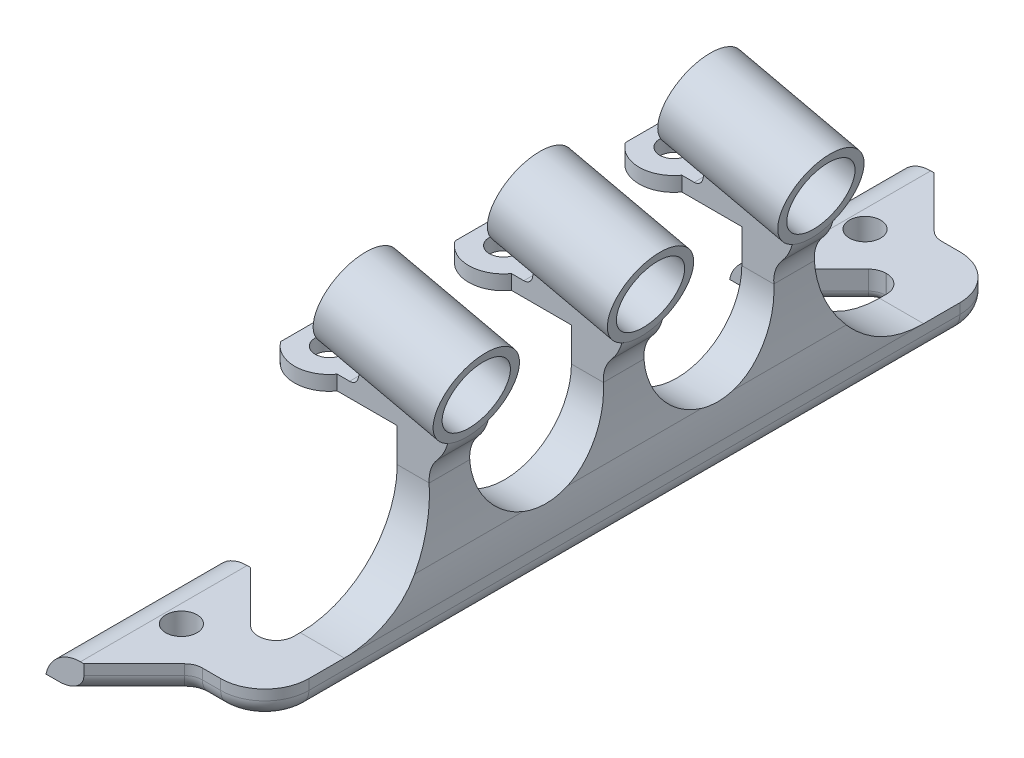
from build123d import *

# Parameters (mm, degrees)
BOSS_EXTRUDE1_START       = -16
BOSS_EXTRUDE1_OUTLINE_W   = 6.35
BOSS_EXTRUDE1_OUTLINE_H   = 4.021831578
BOSS_EXTRUDE1_DEPTH       = 106.425
BOSS_EXTRUDE1_2_DEPTH     = 1.7499999
BOSS_EXTRUDE1_START_2     = -9.7499999
BOSS_EXTRUDE1_3_DEPTH     = 1.7499999
BOSS_EXTRUDE1_START_3     = 82.425
BOSS_EXTRUDE1_4_DEPTH     = 1.7499999
BOSS_EXTRUDE1_START_4     = 88.6750001
BOSS_EXTRUDE1_5_DEPTH     = 1.7499999
BOSS_EXTRUDE1_START_5     = -24
BOSS_EXTRUDE1_6_DEPTH     = 24
BOSS_EXTRUDE1_START_6     = 74.425
BOSS_EXTRUDE1_7_DEPTH     = 24
BOSS_EXTRUDE1_START_7     = -2.010915789
BOSS_EXTRUDE1_8_OUTLINE_R = 2.25
BOSS_EXTRUDE1_8_DEPTH     = 4.021831578
FILLET1_R                 = 6.35
FILLET2_R                 = 2.54
FILLET3_R                 = 2.54
FILLET4_R                 = 2.54
BOSS_EXTRUDE2_DEPTH       = 6.35
CUT_EXTRUDE1_REACH        = 120.218
FILLET5_R                 = 2.54
FILLET6_R                 = 1.27
BOSS_EXTRUDE3_DEPTH       = 5.842
FILLET7_R                 = 1.27
BOSS_EXTRUDE4_DEPTH       = 5.842
BOSS_EXTRUDE5_DEPTH       = 5.842
BOSS_EXTRUDE6_DEPTH       = 5.842
BOSS_EXTRUDE9_DEPTH       = 5.842
BOSS_EXTRUDE10_DEPTH      = 5.842
SKETCH10_R                = 6.0706
SKETCH10_R_2              = 4.8006
BOSS_EXTRUDE7_DEPTH       = 17.463368025
CUT_EXTRUDE3_REACH        = 109.872
SKETCH10_3_R              = 4.8006
BOSS_EXTRUDE8_DEPTH       = 0.254
BOSS_EXTRUDE8_DEPTH_BACK  = 0.889
SKETCH11_R                = 6.0706
SKETCH11_R_2              = 4.1656
CUT_EXTRUDE4_REACH        = 100.485
FILLET8_R                 = 1.27
CUT_EXTRUDE5_REACH        = 105.534
SKETCH16_R                = 2.032
BOSS_EXTRUDE11_DEPTH      = 2.101079944


with BuildPart() as part:
    # Boss-Extrude1: read off the stored shape, not the designer's step
    # Boss-Extrude1 outline → Boss-Extrude1 (new body)
    with BuildSketch(Plane.XY.offset(BOSS_EXTRUDE1_START)):
        with Locations((13.593589293, 0)):
            Rectangle(BOSS_EXTRUDE1_OUTLINE_W, BOSS_EXTRUDE1_OUTLINE_H)
    extrude(amount=BOSS_EXTRUDE1_DEPTH)

    # Boss-Extrude1 2 outline → Boss-Extrude1 2 (add)
    with BuildSketch(Plane.XY.offset(BOSS_EXTRUDE1_START)):
        with BuildLine():
            Line((10.418589293, 2.010915789), (-1.770677328, 2.010915789))
            ThreePointArc((-1.770677328, 2.010915789), (-4.962984209, 0.879061134), (-6.729322672, -2.010915789))
            Line((-6.729322672, -2.010915789), (10.418589293, -2.010915789))
            Line((10.418589293, -2.010915789), (10.418589293, 2.010915789))
        make_face()
    extrude(amount=BOSS_EXTRUDE1_2_DEPTH)

    # Boss-Extrude1 3 outline → Boss-Extrude1 3 (add)
    with BuildSketch(Plane.XY.offset(BOSS_EXTRUDE1_START_2)):
        with BuildLine():
            Line((10.418589293, 2.010915789), (-1.770677328, 2.010915789))
            ThreePointArc((-1.770677328, 2.010915789), (-4.962984209, 0.879061134), (-6.729322672, -2.010915789))
            Line((-6.729322672, -2.010915789), (10.418589293, -2.010915789))
            Line((10.418589293, -2.010915789), (10.418589293, 2.010915789))
        make_face()
    extrude(amount=BOSS_EXTRUDE1_3_DEPTH)

    # Boss-Extrude1 4 outline → Boss-Extrude1 4 (add)
    with BuildSketch(Plane.XY.offset(BOSS_EXTRUDE1_START_3)):
        with BuildLine():
            Line((10.418589293, 2.010915789), (-1.770677328, 2.010915789))
            ThreePointArc((-1.770677328, 2.010915789), (-4.962984209, 0.879061134), (-6.729322672, -2.010915789))
            Line((-6.729322672, -2.010915789), (10.418589293, -2.010915789))
            Line((10.418589293, -2.010915789), (10.418589293, 2.010915789))
        make_face()
    extrude(amount=BOSS_EXTRUDE1_4_DEPTH)

    # Boss-Extrude1 5 outline → Boss-Extrude1 5 (add)
    with BuildSketch(Plane.XY.offset(BOSS_EXTRUDE1_START_4)):
        with BuildLine():
            Line((10.418589293, 2.010915789), (-1.770677328, 2.010915789))
            ThreePointArc((-1.770677328, 2.010915789), (-4.962984209, 0.879061134), (-6.729322672, -2.010915789))
            Line((-6.729322672, -2.010915789), (10.418589293, -2.010915789))
            Line((10.418589293, -2.010915789), (10.418589293, 2.010915789))
        make_face()
    extrude(amount=BOSS_EXTRUDE1_5_DEPTH)

    # Boss-Extrude1 6 outline → Boss-Extrude1 6 (add)
    with BuildSketch(Plane.XY.offset(BOSS_EXTRUDE1_START_5)):
        with BuildLine():
            Line((10.418589293, 2.010915789), (-1.770677328, 2.010915789))
            ThreePointArc((-1.770677328, 2.010915789), (-4.962984209, 0.879061134), (-6.729322672, -2.010915789))
            Line((-6.729322672, -2.010915789), (10.418589293, -2.010915789))
            Line((10.418589293, -2.010915789), (10.418589293, 2.010915789))
        make_face()
    extrude(amount=BOSS_EXTRUDE1_6_DEPTH)

    # Boss-Extrude1 7 outline → Boss-Extrude1 7 (add)
    with BuildSketch(Plane.XY.offset(BOSS_EXTRUDE1_START_6)):
        with BuildLine():
            Line((10.418589293, 2.010915789), (-1.770677328, 2.010915789))
            ThreePointArc((-1.770677328, 2.010915789), (-4.962984209, 0.879061134), (-6.729322672, -2.010915789))
            Line((-6.729322672, -2.010915789), (10.418589293, -2.010915789))
            Line((10.418589293, -2.010915789), (10.418589293, 2.010915789))
        make_face()
    extrude(amount=BOSS_EXTRUDE1_7_DEPTH)

    # Boss-Extrude1 8 outline → Boss-Extrude1 8 (cut)
    with BuildSketch(Plane(origin=(0, 0, 0), x_dir=(1, 0, 0), z_dir=(0, 1, 0)).offset(BOSS_EXTRUDE1_START_7)):
        with Locations((0.766589293, 12)):
            Circle(BOSS_EXTRUDE1_8_OUTLINE_R)
        Polygon((10.418589293, 8), (6.729322672, 8), (-1.270677328, 0), (10.418589293, 0), align=None)
        Polygon((10.418589293, -82.425), (10.418589293, -74.425), (-1.270677328, -74.425), (6.729322672, -82.425), align=None)
        Polygon((10.418589293, 24), (-1.270677328, 24), (6.729322672, 16), (10.418589293, 16), align=None)
        Polygon((10.418589293, -90.425), (6.729322672, -90.425), (-1.270677328, -98.425), (10.418589293, -98.425), align=None)
        with Locations((0.766589293, -86.425)):
            Circle(BOSS_EXTRUDE1_8_OUTLINE_R)
    extrude(amount=BOSS_EXTRUDE1_8_DEPTH, mode=Mode.SUBTRACT)

    # Fillet1
    fillet1_edges = [part.edges().sort_by_distance(p)[0] for p in [
        (16.768589293, 0, 90.425),
        (16.768589293, 0, -16),
    ]]
    fillet(fillet1_edges, radius=FILLET1_R)

    # Fillet2
    fillet2_edges = [part.edges().sort_by_distance(p)[0] for p in [
        (10.418589293, 0, -8),
        (10.418589293, 0, 82.425),
    ]]
    fillet(fillet2_edges, radius=FILLET2_R)

    # Fillet3
    fillet3_edges = [part.edges().sort_by_distance(p)[0] for p in [
        (6.729322672, 0, 82.425),
        (6.729322672, 0, 90.425),
    ]]
    fillet(fillet3_edges, radius=FILLET3_R)

    # Fillet4
    fillet4_edges = [part.edges().sort_by_distance(p)[0] for p in [
        (6.729322672, 0, -8),
        (6.729322672, 0, -16),
    ]]
    fillet(fillet4_edges, radius=FILLET4_R)

    # Sketch2 → Boss-Extrude2 (add)
    with BuildSketch(Plane(origin=(16.768589293, 0, 0), x_dir=(0, 0, -1), z_dir=(1, 0, 0))):
        with BuildLine():
            Line((-34.079833333, 24.520915789), (-39.921833333, 24.520915789))
            Line((-39.921833333, 24.520915789), (-39.921833333, 15.980915789))
            ThreePointArc((-39.921833333, 15.980915789), (-49.542083333, 6.360665789), (-59.162333333, 15.980915789))
            Line((-59.162333333, 15.980915789), (-59.162333333, 24.520915789))
            Line((-59.162333333, 24.520915789), (-65.004333333, 24.520915789))
            Line((-65.004333333, 24.520915789), (-65.004333333, 15.980915789))
            ThreePointArc((-65.004333333, 15.980915789), (-69.0960516, 6.102634055), (-78.974333333, 2.010915789))
            Line((-78.974333333, 2.010915789), (4.422333333, 2.010915789))
            ThreePointArc((4.422333333, 2.010915789), (-5.4559484, 6.102634055), (-9.547666667, 15.980915789))
            Line((-9.547666667, 15.980915789), (-9.547666667, 24.520915789))
            Line((-9.547666667, 24.520915789), (-15.389666667, 24.520915789))
            Line((-15.389666667, 24.520915789), (-15.389666667, 15.980915789))
            ThreePointArc((-15.389666667, 15.980915789), (-24.73475, 6.635832455), (-34.079833333, 15.980915789))
            Line((-34.079833333, 15.980915789), (-34.079833333, 24.520915789))
        make_face()
    extrude(amount=-BOSS_EXTRUDE2_DEPTH)

    # Cut-Extrude1: up to this face of the body (flat: up to its plane)
    cut_extrude1_end = Plane(part.part.faces().sort_by_distance((9.100007207, 0, 90.425))[0])
    # Sketch3 → Cut-Extrude1 (cut, up to the picked face)
    with BuildSketch(Plane(origin=(0, 0, -16), x_dir=(-1, 0, 0), z_dir=(0, 0, -1)), mode=Mode.PRIVATE) as cut_extrude1_sk1:
        with BuildLine():
            Line((-14.863589293, 24.520915789), (-14.863589293, 20.549242432))
            ThreePointArc((-14.863589293, 20.549242432), (-15.214793348, 13.695827108), (-16.264726041, 6.914213198))
            ThreePointArc((-16.264726041, 6.914213198), (-16.642292686, 4.475474759), (-16.768589293, 2.010915789))
            Line((-16.768589293, 2.010915789), (-20.247484628, 2.010915789))
            Line((-20.247484628, 2.010915789), (-20.247484628, 24.520915789))
            Line((-20.247484628, 24.520915789), (-14.863589293, 24.520915789))
        make_face()
    cut_extrude1_tool1 = split(extrude(cut_extrude1_sk1.sketch, amount=-CUT_EXTRUDE1_REACH, mode=Mode.PRIVATE), bisect_by=cut_extrude1_end, keep=Keep.BOTH, mode=Mode.PRIVATE)
    add(cut_extrude1_tool1.solids().sort_by(Axis((17.836631, 14.156787, -16), (0, 0, 1)))[0], mode=Mode.SUBTRACT)

    # Fillet5
    fillet5_edges = [part.edges().sort_by_distance(p)[0] for p in [
        (14.908717354, -2.010915789, -14.140128061),
        (6.809409202, -2.010915789, 90.618345987),
        (2.357348284, -2.010915789, -20.371974388),
        (9.100007207, -2.010915789, -16),
        (6.809409202, -2.010915789, -16.193345987),
        (2.357348284, -2.010915789, 94.796974388),
        (16.768589293, -2.010915789, 37.2125),
        (9.100007207, -2.010915789, 90.425),
        (14.908717354, -2.010915789, 88.565128061),
    ]]
    fillet(fillet5_edges, radius=FILLET5_R)

    # Fillet6
    fillet6_edges = [part.edges().sort_by_distance(p)[0] for p in [
        (10.418589293, -2.010915789, 37.2125),
        (7.830007207, -2.010915789, -8),
        (9.674640517, -2.010915789, 81.681051224),
        (9.674640517, -2.010915789, -7.256051224),
        (2.357348284, -2.010915789, 78.053025612),
        (7.830007207, -2.010915789, 82.425),
        (6.809409202, -2.010915789, 82.231654013),
        (6.809409202, -2.010915789, -7.806654013),
        (2.357348284, -2.010915789, -3.628025612),
    ]]
    fillet(fillet6_edges, radius=FILLET6_R)

    # Sketch4 → Boss-Extrude3 (add)
    with BuildSketch(Plane(origin=(0, 0, 9.547666667), x_dir=(-1, 0, 0), z_dir=(0, 0, -1))):
        with BuildLine():
            Line((-10.418589293, 20.837915789), (6.348657983, 20.837915789))
            Line((6.348657983, 20.837915789), (6.348657983, 22.938995732))
            Line((6.348657983, 22.938995732), (3.683686756, 22.938995732))
            ThreePointArc((3.683686756, 22.938995732), (-0.819680991, 23.190788318), (-5.266911259, 23.943027313))
            ThreePointArc((-5.266911259, 23.943027313), (-7.826594807, 24.375992027), (-10.418589293, 24.520915789))
            Line((-10.418589293, 24.520915789), (-10.418589293, 20.837915789))
        make_face()
    extrude(amount=-BOSS_EXTRUDE3_DEPTH)

    # Fillet7
    fillet7_edges = [part.edges().sort_by_distance(p)[0] for p in [
        (14.863589293, 24.520915789, 37.000833333),
        (14.863589293, 24.520915789, 12.468666667),
        (14.863589293, 24.520915789, 62.083333333),
    ]]
    fillet(fillet7_edges, radius=FILLET7_R)

    # Sketch5 → Boss-Extrude4 (add)
    with BuildSketch(Plane(origin=(0, 0, 34.079833333), x_dir=(-1, 0, 0), z_dir=(0, 0, -1))):
        with BuildLine():
            Line((6.348657983, 20.837915789), (6.348657983, 22.938995732))
            Line((6.348657983, 22.938995732), (3.683686756, 22.938995732))
            ThreePointArc((3.683686756, 22.938995732), (-0.819680991, 23.190788318), (-5.266911259, 23.943027313))
            ThreePointArc((-5.266911259, 23.943027313), (-7.826594807, 24.375992027), (-10.418589293, 24.520915789))
            Line((-10.418589293, 24.520915789), (-10.418589293, 20.837915789))
            Line((-10.418589293, 20.837915789), (6.348657983, 20.837915789))
        make_face()
    extrude(amount=-BOSS_EXTRUDE4_DEPTH)

    # Sketch6 → Boss-Extrude5 (add)
    with BuildSketch(Plane(origin=(0, 0, 59.162333333), x_dir=(-1, 0, 0), z_dir=(0, 0, -1))):
        with BuildLine():
            Line((6.348657983, 20.837915789), (6.348657983, 22.938995732))
            Line((6.348657983, 22.938995732), (3.683686756, 22.938995732))
            ThreePointArc((3.683686756, 22.938995732), (-0.819680991, 23.190788318), (-5.266911259, 23.943027313))
            ThreePointArc((-5.266911259, 23.943027313), (-7.826594807, 24.375992027), (-10.418589293, 24.520915789))
            Line((-10.418589293, 24.520915789), (-10.418589293, 20.837915789))
            Line((-10.418589293, 20.837915789), (6.348657983, 20.837915789))
        make_face()
    extrude(amount=-BOSS_EXTRUDE5_DEPTH)

    # Sketch9 → Boss-Extrude6 (add)
    with BuildSketch(Plane(origin=(0, 0, 9.547666667), x_dir=(-1, 0, 0), z_dir=(0, 0, -1))):
        with BuildLine():
            Line((-5.166750347, 25.4407495), (-1.363630576, 26.307289429))
            Line((-1.363630576, 26.307289429), (-3.585939736, 36.060686375))
            Line((-3.585939736, 36.060686375), (-7.389059506, 35.194146446))
            Line((-7.389059506, 35.194146446), (-19.993785734, 32.322162592))
            Line((-19.993785734, 32.322162592), (-17.768385814, 22.555200738))
            ThreePointArc((-17.768385814, 22.555200738), (-17.171345507, 20.90689701), (-16.189450906, 19.454572908))
            ThreePointArc((-16.189450906, 19.454572908), (-15.258602737, 17.834230405), (-15.019410191, 15.980915789))
            ThreePointArc((-15.019410191, 15.980915789), (-14.902555842, 18.263750774), (-14.863589293, 20.549242432))
            Line((-14.863589293, 20.549242432), (-14.863589293, 23.250915789))
            ThreePointArc((-14.863589293, 23.250915789), (-14.491614906, 24.148941401), (-13.593589293, 24.520915789))
            Line((-13.593589293, 24.520915789), (-10.418589293, 24.520915789))
            ThreePointArc((-10.418589293, 24.520915789), (-7.826594807, 24.375992027), (-5.266911259, 23.943027313))
            ThreePointArc((-5.266911259, 23.943027313), (-4.242282662, 23.724156149), (-3.21232258, 23.53193082))
            ThreePointArc((-3.21232258, 23.53193082), (-4.470802762, 24.198353318), (-5.166750347, 25.4407495))
        make_face()
    extrude(amount=-BOSS_EXTRUDE6_DEPTH)

    # Sketch12 → Boss-Extrude9 (add)
    with BuildSketch(Plane(origin=(0, 0, 34.079833333), x_dir=(-1, 0, 0), z_dir=(0, 0, -1))):
        with BuildLine():
            Line((-13.593589293, 24.520915789), (-10.418589293, 24.520915789))
            ThreePointArc((-10.418589293, 24.520915789), (-7.826594807, 24.375992027), (-5.266911259, 23.943027313))
            ThreePointArc((-5.266911259, 23.943027313), (-4.242282662, 23.724156149), (-3.21232258, 23.53193082))
            ThreePointArc((-3.21232258, 23.53193082), (-4.470802762, 24.198353318), (-5.166750347, 25.4407495))
            Line((-5.166750347, 25.4407495), (-1.363630576, 26.307289429))
            Line((-1.363630576, 26.307289429), (-3.585939736, 36.060686375))
            Line((-3.585939736, 36.060686375), (-7.389059506, 35.194146446))
            Line((-7.389059506, 35.194146446), (-19.993785734, 32.322162592))
            Line((-19.993785734, 32.322162592), (-17.768385814, 22.555200738))
            ThreePointArc((-17.768385814, 22.555200738), (-17.171345507, 20.90689701), (-16.189450906, 19.454572908))
            ThreePointArc((-16.189450906, 19.454572908), (-15.258602737, 17.834230405), (-15.019410191, 15.980915789))
            ThreePointArc((-15.019410191, 15.980915789), (-14.902555842, 18.263750774), (-14.863589293, 20.549242432))
            Line((-14.863589293, 20.549242432), (-14.863589293, 23.250915789))
            ThreePointArc((-14.863589293, 23.250915789), (-14.491614906, 24.148941401), (-13.593589293, 24.520915789))
        make_face()
    extrude(amount=-BOSS_EXTRUDE9_DEPTH)

    # Sketch14 → Boss-Extrude10 (add)
    with BuildSketch(Plane(origin=(0, 0, 59.162333333), x_dir=(-1, 0, 0), z_dir=(0, 0, -1))):
        with BuildLine():
            Line((-13.593589293, 24.520915789), (-10.418589293, 24.520915789))
            ThreePointArc((-10.418589293, 24.520915789), (-7.826594807, 24.375992027), (-5.266911259, 23.943027313))
            ThreePointArc((-5.266911259, 23.943027313), (-4.242282662, 23.724156149), (-3.21232258, 23.53193082))
            ThreePointArc((-3.21232258, 23.53193082), (-4.470802762, 24.198353318), (-5.166750347, 25.4407495))
            Line((-5.166750347, 25.4407495), (-1.363630576, 26.307289429))
            Line((-1.363630576, 26.307289429), (-3.585939736, 36.060686375))
            Line((-3.585939736, 36.060686375), (-7.389059506, 35.194146446))
            Line((-7.389059506, 35.194146446), (-19.993785734, 32.322162592))
            Line((-19.993785734, 32.322162592), (-17.768385814, 22.555200738))
            ThreePointArc((-17.768385814, 22.555200738), (-17.171345507, 20.90689701), (-16.189450906, 19.454572908))
            ThreePointArc((-16.189450906, 19.454572908), (-15.258602737, 17.834230405), (-15.019410191, 15.980915789))
            ThreePointArc((-15.019410191, 15.980915789), (-14.902555842, 18.263750774), (-14.863589293, 20.549242432))
            Line((-14.863589293, 20.549242432), (-14.863589293, 23.250915789))
            ThreePointArc((-14.863589293, 23.250915789), (-14.491614906, 24.148941401), (-13.593589293, 24.520915789))
        make_face()
    extrude(amount=-BOSS_EXTRUDE10_DEPTH)

    # Sketch10 → Boss-Extrude7 (add)
    # profile 1 of 3: a face of its own
    with BuildSketch(Plane(origin=(12.005896447, -2.735540632, 0), x_dir=(0, 0, -1), z_dir=(0.9750111225313693, -0.222156050874423, 0))):
        with Locations(Location((-12.468666667, 30.947567263, 0), (0, 0, 90))):
            Circle(SKETCH10_R)
        with Locations(Location((-12.468666667, 30.947567263, 0), (0, 0, 52.521361031))):
            Circle(SKETCH10_R_2, mode=Mode.SUBTRACT)
    # profile 2 of 3: a face of its own
    with BuildSketch(Plane(origin=(12.005896447, -2.735540632, 0), x_dir=(0, 0, -1), z_dir=(0.9750111225313693, -0.222156050874423, 0))):
        with Locations(Location((-37.000833333, 30.947567263, 0), (0, 0, 90))):
            Circle(SKETCH10_R)
        with Locations(Location((-37.000833333, 30.947567263, 0), (0, 0, 127.478638969))):
            Circle(SKETCH10_R_2, mode=Mode.SUBTRACT)
    # profile 3 of 3: a face of its own
    with BuildSketch(Plane(origin=(12.005896447, -2.735540632, 0), x_dir=(0, 0, -1), z_dir=(0.9750111225313693, -0.222156050874423, 0))):
        with Locations(Location((-62.083333333, 30.947567263, 0), (0, 0, 90))):
            Circle(SKETCH10_R)
        with Locations(Location((-62.083333333, 30.947567263, 0), (0, 0, 52.521361031))):
            Circle(SKETCH10_R_2, mode=Mode.SUBTRACT)
    extrude(amount=-BOSS_EXTRUDE7_DEPTH)

    # Sketch10<3> → Cut-Extrude3 (cut, up to next)
    with BuildSketch(Plane(origin=(12.005896447, -2.735540632, 0), x_dir=(0, 0, -1), z_dir=(0.9750111225313693, -0.222156050874423, 0)), mode=Mode.PRIVATE) as cut_extrude3_sk1:
        with BuildLine():
            Line((-9.547666667, 27.137905944), (-9.547666667, 30.947567263))
            Line((-9.547666667, 30.947567263), (-15.389666667, 30.947567263))
            Line((-15.389666667, 30.947567263), (-15.389666667, 27.137905944))
            ThreePointArc((-15.389666667, 27.137905944), (-12.468666667, 26.146967263), (-9.547666667, 27.137905944))
        make_face()
    cut_extrude3_tool1 = extrude(cut_extrude3_sk1.sketch, amount=-CUT_EXTRUDE3_REACH, mode=Mode.PRIVATE) & part.part
    # Sketch10<3> → Cut-Extrude3 (cut, up to next)
    with BuildSketch(Plane(origin=(12.005896447, -2.735540632, 0), x_dir=(0, 0, -1), z_dir=(0.9750111225313693, -0.222156050874423, 0)), mode=Mode.PRIVATE) as cut_extrude3_sk2:
        with BuildLine():
            Line((-15.389666667, 30.947567263), (-9.547666667, 30.947567263))
            Line((-9.547666667, 30.947567263), (-9.547666667, 34.757228581))
            ThreePointArc((-9.547666667, 34.757228581), (-12.468666667, 35.748167263), (-15.389666667, 34.757228581))
            Line((-15.389666667, 34.757228581), (-15.389666667, 30.947567263))
        make_face()
    cut_extrude3_tool2 = extrude(cut_extrude3_sk2.sketch, amount=-CUT_EXTRUDE3_REACH, mode=Mode.PRIVATE) & part.part
    # Sketch10<3> → Cut-Extrude3 (cut, up to next)
    with BuildSketch(Plane(origin=(12.005896447, -2.735540632, 0), x_dir=(0, 0, -1), z_dir=(0.9750111225313693, -0.222156050874423, 0)), mode=Mode.PRIVATE) as cut_extrude3_sk3:
        with BuildLine():
            Line((-9.547666667, 27.137905944), (-9.547666667, 30.947567263))
            Line((-9.547666667, 30.947567263), (-15.389666667, 30.947567263))
            Line((-15.389666667, 30.947567263), (-15.389666667, 27.137905944))
            ThreePointArc((-15.389666667, 27.137905944), (-12.468666667, 26.146967263), (-9.547666667, 27.137905944))
        make_face()
    cut_extrude3_tool3 = extrude(cut_extrude3_sk3.sketch, amount=-CUT_EXTRUDE3_REACH, mode=Mode.PRIVATE) & part.part
    # Sketch10<3> → Cut-Extrude3 (cut, up to next)
    with BuildSketch(Plane(origin=(12.005896447, -2.735540632, 0), x_dir=(0, 0, -1), z_dir=(0.9750111225313693, -0.222156050874423, 0)), mode=Mode.PRIVATE) as cut_extrude3_sk4:
        with BuildLine():
            Line((-15.389666667, 30.947567263), (-9.547666667, 30.947567263))
            Line((-9.547666667, 30.947567263), (-9.547666667, 34.757228581))
            ThreePointArc((-9.547666667, 34.757228581), (-12.468666667, 35.748167263), (-15.389666667, 34.757228581))
            Line((-15.389666667, 34.757228581), (-15.389666667, 30.947567263))
        make_face()
    cut_extrude3_tool4 = extrude(cut_extrude3_sk4.sketch, amount=-CUT_EXTRUDE3_REACH, mode=Mode.PRIVATE) & part.part
    # Sketch10<3> → Cut-Extrude3 (cut, up to next)
    with BuildSketch(Plane(origin=(12.005896447, -2.735540632, 0), x_dir=(0, 0, -1), z_dir=(0.9750111225313693, -0.222156050874423, 0)), mode=Mode.PRIVATE) as cut_extrude3_sk5:
        with Locations(Location((-37.000833333, 30.947567263, 0), (0, 0, 90))):
            Circle(SKETCH10_3_R)
    cut_extrude3_tool5 = extrude(cut_extrude3_sk5.sketch, amount=-CUT_EXTRUDE3_REACH, mode=Mode.PRIVATE) & part.part
    # Sketch10<3> → Cut-Extrude3 (cut, up to next)
    with BuildSketch(Plane(origin=(12.005896447, -2.735540632, 0), x_dir=(0, 0, -1), z_dir=(0.9750111225313693, -0.222156050874423, 0)), mode=Mode.PRIVATE) as cut_extrude3_sk6:
        with Locations(Location((-62.083333333, 30.947567263, 0), (0, 0, 90))):
            Circle(SKETCH10_3_R)
    cut_extrude3_tool6 = extrude(cut_extrude3_sk6.sketch, amount=-CUT_EXTRUDE3_REACH, mode=Mode.PRIVATE) & part.part
    add(cut_extrude3_tool1.solids().sort_by_distance((18.380788, 25.242945, 12.468667))[0], mode=Mode.SUBTRACT)
    add(cut_extrude3_tool2.solids().sort_by_distance((19.381384, 29.634418, 12.468667))[0], mode=Mode.SUBTRACT)
    add(cut_extrude3_tool3.solids().sort_by_distance((18.380788, 25.242945, 12.468667))[0], mode=Mode.SUBTRACT)
    add(cut_extrude3_tool4.solids().sort_by_distance((19.381384, 29.634418, 12.468667))[0], mode=Mode.SUBTRACT)
    add(cut_extrude3_tool5.solids().sort_by_distance((18.881086, 27.438682, 37.000833))[0], mode=Mode.SUBTRACT)
    add(cut_extrude3_tool6.solids().sort_by_distance((18.881086, 27.438682, 62.083333))[0], mode=Mode.SUBTRACT)

    # Sketch11 → Boss-Extrude8 (add, two sides: drawn at the far end of the back side and taken through both)
    # profile 1 of 3: a face of its own
    with BuildSketch(Plane(origin=(-5.021081615, 1.144052244, 0), x_dir=(0, 0, 1), z_dir=(-0.9750111225313693, 0.22215605087442342, 0)).offset(-BOSS_EXTRUDE8_DEPTH_BACK)):
        with Locations(Location((12.468666667, 30.947567263, 0), (0, 0, 90))):
            Circle(SKETCH11_R)
        with Locations(Location((12.468666667, 30.947567263, 0), (0, 0, 270))):
            Circle(SKETCH11_R_2, mode=Mode.SUBTRACT)
    # profile 2 of 3: a face of its own
    with BuildSketch(Plane(origin=(-5.021081615, 1.144052244, 0), x_dir=(0, 0, 1), z_dir=(-0.9750111225313693, 0.22215605087442342, 0)).offset(-BOSS_EXTRUDE8_DEPTH_BACK)):
        with Locations(Location((37.000833333, 30.947567263, 0), (0, 0, 90))):
            Circle(SKETCH11_R)
        with Locations(Location((37.000833333, 30.947567263, 0), (0, 0, 270))):
            Circle(SKETCH11_R_2, mode=Mode.SUBTRACT)
    # profile 3 of 3: a face of its own
    with BuildSketch(Plane(origin=(-5.021081615, 1.144052244, 0), x_dir=(0, 0, 1), z_dir=(-0.9750111225313693, 0.22215605087442342, 0)).offset(-BOSS_EXTRUDE8_DEPTH_BACK)):
        with Locations(Location((62.083333333, 30.947567263, 0), (0, 0, 90))):
            Circle(SKETCH11_R)
        with Locations(Location((62.083333333, 30.947567263, 0), (0, 0, 270))):
            Circle(SKETCH11_R_2, mode=Mode.SUBTRACT)
    extrude(amount=BOSS_EXTRUDE8_DEPTH + BOSS_EXTRUDE8_DEPTH_BACK)

    # Cut-Extrude4: up to this face of the body (flat: up to its plane)
    cut_extrude4_end = Plane(part.part.faces().sort_by_distance((7.87272568, 21.190232304, 65.004333333))[0])
    # Sketch15 → Cut-Extrude4 (cut, up to the picked face)
    with BuildSketch(Plane(origin=(0, 0, 9.547666667), x_dir=(-1, 0, 0), z_dir=(0, 0, -1)), mode=Mode.PRIVATE) as cut_extrude4_sk1:
        with BuildLine():
            Line((3.683686756, 22.938995732), (-4.57487442, 22.938995732))
            Line((-4.57487442, 22.938995732), (-5.073349654, 25.126732215))
            ThreePointArc((-5.073349654, 25.126732215), (-4.349889034, 24.087714545), (-3.21232258, 23.53193082))
            ThreePointArc((-3.21232258, 23.53193082), (0.22296007, 23.087502468), (3.683686756, 22.938995732))
        make_face()
    cut_extrude4_tool1 = split(extrude(cut_extrude4_sk1.sketch, amount=-CUT_EXTRUDE4_REACH, mode=Mode.PRIVATE), bisect_by=cut_extrude4_end, keep=Keep.BOTH, mode=Mode.PRIVATE)
    add(cut_extrude4_tool1.solids().sort_by(Axis((2.888871, 23.342029, 9.547667), (0, 0, 1)))[0], mode=Mode.SUBTRACT)

    # Fillet8
    fillet8_edges = [part.edges().sort_by_distance(p)[0] for p in [
        (4.57487442, 22.938995732, 37.000833333),
        (4.57487442, 22.938995732, 12.468666667),
        (4.57487442, 22.938995732, 62.083333333),
    ]]
    fillet(fillet8_edges, radius=FILLET8_R)

    # Sketch16 → Cut-Extrude5 (cut, up to next)
    with BuildSketch(Plane(origin=(0, 22.938995732, 0), x_dir=(1, 0, 0), z_dir=(0, 1, 0)), mode=Mode.PRIVATE) as cut_extrude5_sk1:
        with Locations(Location((-2.284657983, -62.083333333, 0), (0, 0, 180))):
            Circle(SKETCH16_R)
    cut_extrude5_tool1 = extrude(cut_extrude5_sk1.sketch, amount=-CUT_EXTRUDE5_REACH, mode=Mode.PRIVATE) & part.part
    # Sketch16 → Cut-Extrude5 (cut, up to next)
    with BuildSketch(Plane(origin=(0, 22.938995732, 0), x_dir=(1, 0, 0), z_dir=(0, 1, 0)), mode=Mode.PRIVATE) as cut_extrude5_sk2:
        with Locations(Location((-2.284657983, -37.000833333, 0), (0, 0, 180))):
            Circle(SKETCH16_R)
    cut_extrude5_tool2 = extrude(cut_extrude5_sk2.sketch, amount=-CUT_EXTRUDE5_REACH, mode=Mode.PRIVATE) & part.part
    # Sketch16 → Cut-Extrude5 (cut, up to next)
    with BuildSketch(Plane(origin=(0, 22.938995732, 0), x_dir=(1, 0, 0), z_dir=(0, 1, 0)), mode=Mode.PRIVATE) as cut_extrude5_sk3:
        with Locations(Location((-2.284657983, -12.468666667, 0), (0, 0, 180))):
            Circle(SKETCH16_R)
    cut_extrude5_tool3 = extrude(cut_extrude5_sk3.sketch, amount=-CUT_EXTRUDE5_REACH, mode=Mode.PRIVATE) & part.part
    add(cut_extrude5_tool1.solids().sort_by_distance((-2.284658, 22.938996, 62.083333))[0], mode=Mode.SUBTRACT)
    add(cut_extrude5_tool2.solids().sort_by_distance((-2.284658, 22.938996, 37.000833))[0], mode=Mode.SUBTRACT)
    add(cut_extrude5_tool3.solids().sort_by_distance((-2.284658, 22.938996, 12.468667))[0], mode=Mode.SUBTRACT)

    # Sketch17 → Boss-Extrude11 (add)
    with BuildSketch(Plane(origin=(0, 22.938995732, 0), x_dir=(1, 0, 0), z_dir=(0, 1, 0))):
        with BuildLine():
            Line((-6.348657983, -59.162333333), (1.779342017, -59.162333333))
            ThreePointArc((1.779342017, -59.162333333), (-2.284657983, -57.078501968), (-6.348657983, -59.162333333))
        make_face()
        with BuildLine():
            Line((-6.348657983, -65.004333333), (1.779342017, -65.004333333))
            ThreePointArc((1.779342017, -65.004333333), (-2.284657983, -67.088164699), (-6.348657983, -65.004333333))
        make_face()
        with BuildLine():
            Line((-6.348657983, -34.079833333), (1.779342017, -34.079833333))
            ThreePointArc((1.779342017, -34.079833333), (-2.284657983, -31.996001968), (-6.348657983, -34.079833333))
        make_face()
        with BuildLine():
            Line((-6.348657983, -39.921833333), (1.779342017, -39.921833333))
            ThreePointArc((1.779342017, -39.921833333), (-2.284657983, -42.005664699), (-6.348657983, -39.921833333))
        make_face()
        with BuildLine():
            Line((-6.348657983, -9.547666667), (1.779342017, -9.547666667))
            ThreePointArc((1.779342017, -9.547666667), (-2.284657983, -7.463835301), (-6.348657983, -9.547666667))
        make_face()
        with BuildLine():
            Line((-6.348657983, -15.389666667), (1.779342017, -15.389666667))
            ThreePointArc((1.779342017, -15.389666667), (-2.284657983, -17.473498032), (-6.348657983, -15.389666667))
        make_face()
    extrude(amount=-BOSS_EXTRUDE11_DEPTH)


solid = part.part
